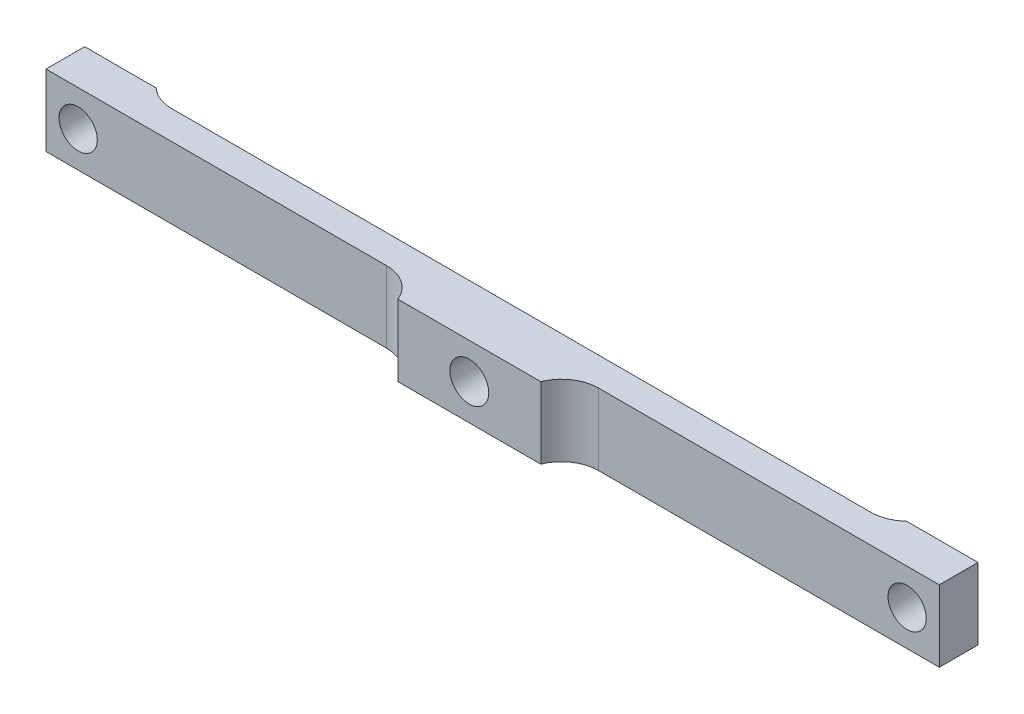
from build123d import *

# Parameters (mm, degrees)
SKETCH1_W             = 79.375
SKETCH1_H             = 6.35
BOSS_EXTRUDE1_DEPTH   = 5.5118
SKETCH10_W            = 66.675
SKETCH10_H            = 6.35
CUT_EXTRUDE2_DEPTH    = 0.89916
SKETCH2_W             = 33.3375
SKETCH2_H             = 6.35
CUT_EXTRUDE1_DEPTH    = 2.07264
M3_CLEARANCE_HOLE1_D  = 3.4
F_8_32_TAPPED_HOLE1_D = 3.4544
FILLET1_R             = 3.302


with BuildPart() as part:
    # Sketch1 → Boss-Extrude1 (new body)
    with BuildSketch(Plane.XY):
        Rectangle(SKETCH1_W, SKETCH1_H)
    extrude(amount=BOSS_EXTRUDE1_DEPTH)

    # Sketch10 → Cut-Extrude2 (cut)
    with BuildSketch(Plane(origin=(0, 0, 0), x_dir=(-1, 0, 0), z_dir=(0, 0, -1))):
        Rectangle(SKETCH10_W, SKETCH10_H)
    extrude(amount=-CUT_EXTRUDE2_DEPTH, mode=Mode.SUBTRACT)

    # Sketch2 → Cut-Extrude1 (cut)
    with BuildSketch(Plane.XY.offset(5.5118)):
        with Locations((23.01875, 0)):
            Rectangle(SKETCH2_W, SKETCH2_H)
    cut_extrude1 = extrude(amount=-CUT_EXTRUDE1_DEPTH, mode=Mode.SUBTRACT)

    # M3 Clearance Hole1 (through all)
    with Locations(Plane.XY.offset(3.43916)):
        with Locations((36.83, 0)):
            m3_clearance_hole1 = Hole(M3_CLEARANCE_HOLE1_D / 2)

    # Mirror2: Cut-Extrude1, M3 Clearance Hole1 across plane
    add(cut_extrude1.mirror(Plane(origin=(0, 0, 0), x_dir=(0, 0, 1), z_dir=(1, 0, 0))), mode=Mode.SUBTRACT)
    add(m3_clearance_hole1.mirror(Plane(origin=(0, 0, 0), x_dir=(0, 0, 1), z_dir=(1, 0, 0))), mode=Mode.SUBTRACT)

    # #8-32 Tapped Hole1 (through all)
    with Locations(Plane.XY.offset(5.5118)):
        with Locations((0, 0)):
            Hole(F_8_32_TAPPED_HOLE1_D / 2)

    # Fillet1
    # the kernel refuses this fillet: 3.302 mm, written as the material it adds along each edge
    with BuildSketch(Plane(origin=(33.3375, 3.175, 0.89916), x_dir=(-1, 0, 0), z_dir=(0, -1, 0))) as fillet1_piece_1:
        with BuildLine():
            CenterArc((2.264854065, 3.302), FILLET1_R, 226.693279333, 43.306720667)
            Line((0, 0.89916), (-0.045297081, 0.8511032))
            ThreePointArc((-0.045297081, 0.8511032), (-0.06604, 0.44958), (-0.06604, 0))
            Line((-0.06604, 0), (0, -0.06604))
            Line((0, -0.06604), (2.264854065, -0.06604))
            Line((2.264854065, -0.06604), (2.264854065, 0))
        make_face()
    extrude(amount=6.35)
    with BuildSketch(Plane(origin=(6.35, 3.175, 3.43916), x_dir=(1, 0, 0), z_dir=(0, -1, 0))) as fillet1_piece_2:
        with BuildLine():
            CenterArc((3.064617103, 3.302), FILLET1_R, 201.858009222, 68.141990778)
            Line((0, 2.07264), (-0.061292342, 2.0480528))
            ThreePointArc((-0.061292342, 2.0480528), (-0.06604, 1.03632), (-0.06604, 0))
            Line((-0.06604, 0), (0, -0.06604))
            Line((0, -0.06604), (3.064617103, -0.06604))
            Line((3.064617103, -0.06604), (3.064617103, 0))
        make_face()
    extrude(amount=6.35)
    with BuildSketch(Plane(origin=(-6.35, 3.175, 3.43916), x_dir=(0, 0, 1), z_dir=(0, -1, 0))) as fillet1_piece_3:
        with BuildLine():
            CenterArc((3.302, 3.064617103), FILLET1_R, 180, 68.141990778)
            Line((0, 3.064617103), (-0.06604, 3.064617103))
            Line((-0.06604, 3.064617103), (-0.06604, 0))
            Line((-0.06604, 0), (0, -0.06604))
            ThreePointArc((0, -0.06604), (1.03632, -0.06604), (2.0480528, -0.061292342))
            Line((2.0480528, -0.061292342), (2.07264, 0))
        make_face()
    extrude(amount=6.35)
    with BuildSketch(Plane(origin=(-33.3375, -3.175, 0.89916), x_dir=(0, 0, -1), z_dir=(0, 1, 0))) as fillet1_piece_4:
        with BuildLine():
            CenterArc((3.302, -2.264854065), FILLET1_R, 136.693279333, 43.306720667)
            Line((0, -2.264854065), (-0.06604, -2.264854065))
            Line((-0.06604, -2.264854065), (-0.06604, 0))
            Line((-0.06604, 0), (0, 0.06604))
            ThreePointArc((0, 0.06604), (0.44958, 0.06604), (0.8511032, 0.045297081))
            Line((0.8511032, 0.045297081), (0.89916, 0))
        make_face()
    extrude(amount=6.35)


solid = part.part
